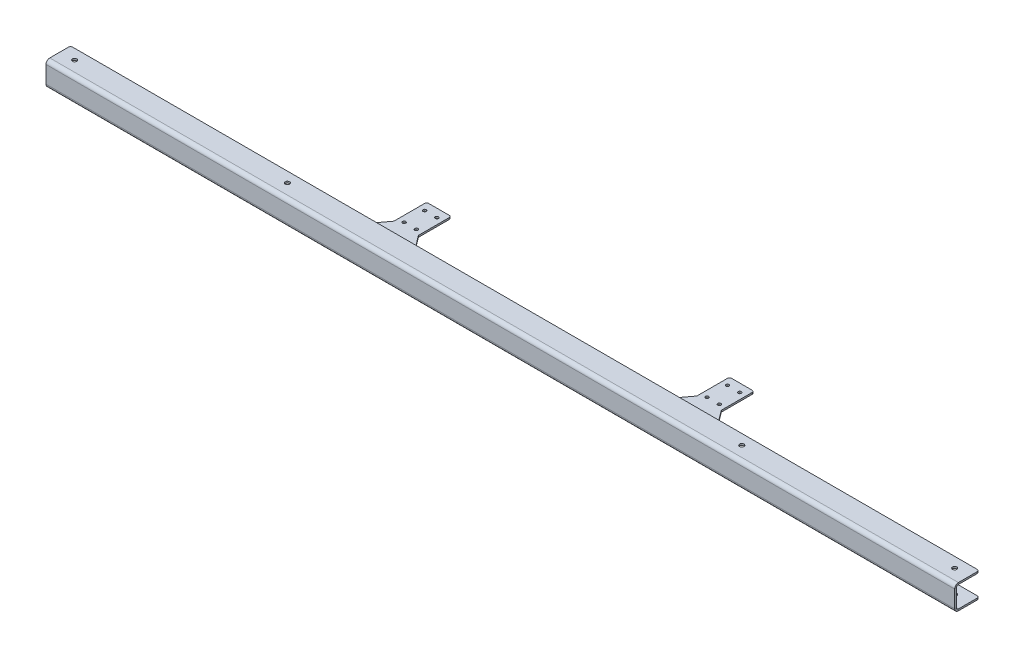
from build123d import *

# Parameters (mm, degrees)
BASE_FLANGE1_DEPTH               = 2.65684
EDGE_FLANGE3_STRIP_W             = 16.97736
EDGE_FLANGE3_STRIP_H             = 2.65684
EDGE_FLANGE3_STRIP_CUT_DEPTH     = 1409.7
EDGE_FLANGE3_DEPTH               = 1409.7
EDGE_FLANGE4_STRIP_W             = 16.97736
EDGE_FLANGE4_STRIP_H             = 2.65684
EDGE_FLANGE4_STRIP_CUT_DEPTH     = 1409.7
EDGE_FLANGE4_DEPTH               = 1409.7
F_10_0_1935_DIAMETER_HOLE1_D     = 4.9149
F_17_64_0_26563_DIAMETER_HOLE1_D = 6.747002
FILLET1_R                        = 3.175


# Sheet-metal steps are written as plain solids
with BuildPart() as part:
    # Sketch1 → Base-Flange1 (new body)
    with BuildSketch(Plane(origin=(0, 0, 0), x_dir=(1, 0, 0), z_dir=(0, 1, 0))):
        Polygon((0, 0), (1409.7, 0), (1409.7, 38.1), (996.95, 38.1), (958.85, 88.9), (958.85, 139.7), (920.75, 139.7), (920.75, 88.9), (882.65, 38.1), (527.05, 38.1), (488.95, 88.9), (488.95, 139.7), (450.85, 139.7), (450.85, 88.9), (412.75, 38.1), (0, 38.1), align=None)
    extrude(amount=-BASE_FLANGE1_DEPTH)

    # Edge-Flange3 strip (across the edge) → Edge-Flange3 strip cut (cut)
    with BuildSketch(Plane(origin=(0, 0, 0), x_dir=(0, 0, -1), z_dir=(1, 0, 0))):
        with Locations((-2.65684, -1.32842)):
            Rectangle(EDGE_FLANGE3_STRIP_W, EDGE_FLANGE3_STRIP_H)
    extrude(amount=EDGE_FLANGE3_STRIP_CUT_DEPTH, mode=Mode.SUBTRACT)

    # Edge-Flange3 section (across the edge) → Edge-Flange3 (add)
    with BuildSketch(Plane(origin=(0, 0, 0), x_dir=(0, 0, -1), z_dir=(1, 0, 0))):
        with BuildLine():
            Line((0, 3.175), (0, 35.44316))
            Line((0, 35.44316), (2.65684, 35.44316))
            Line((2.65684, 35.44316), (2.65684, 3.175))
            ThreePointArc((2.65684, 3.175), (3.58677597, 0.92993597), (5.83184, 0))
            Line((5.83184, 0), (5.83184, -2.65684))
            ThreePointArc((5.83184, -2.65684), (1.708106389, -0.948733611), (0, 3.175))
        make_face()
    extrude(amount=EDGE_FLANGE3_DEPTH)

    # Edge-Flange4 strip (across the edge) → Edge-Flange4 strip cut (cut)
    with BuildSketch(Plane(origin=(0, 35.44316, -2.65684), x_dir=(0, -1, 0), z_dir=(1, 0, 0))):
        with Locations((-2.65684, -1.32842)):
            Rectangle(EDGE_FLANGE4_STRIP_W, EDGE_FLANGE4_STRIP_H)
    extrude(amount=EDGE_FLANGE4_STRIP_CUT_DEPTH, mode=Mode.SUBTRACT)

    # Edge-Flange4 section (across the edge) → Edge-Flange4 (add)
    with BuildSketch(Plane(origin=(0, 35.44316, -2.65684), x_dir=(0, -1, 0), z_dir=(1, 0, 0))):
        with BuildLine():
            Line((0, 3.175), (0, 35.44316))
            Line((0, 35.44316), (2.65684, 35.44316))
            Line((2.65684, 35.44316), (2.65684, 3.175))
            ThreePointArc((2.65684, 3.175), (3.58677597, 0.92993597), (5.83184, 0))
            Line((5.83184, 0), (5.83184, -2.65684))
            ThreePointArc((5.83184, -2.65684), (1.708106389, -0.948733611), (0, 3.175))
        make_face()
    extrude(amount=EDGE_FLANGE4_DEPTH)

    # #10 (0.1935) Diameter Hole1 (through all)
    with Locations(Plane(origin=(0, -2.65684, 0), x_dir=(-1, 0, 0), z_dir=(0, -1, 0))):
        with Locations((-460.375, 127), (-479.425, 127), (-460.375, 63.5), (-479.425, 63.5), (-460.375, 95.25), (-479.425, 95.25), (-930.275, 63.5), (-949.325, 63.5), (-930.275, 95.25), (-949.325, 95.25), (-949.325, 127), (-930.275, 127)):
            Hole(F_10_0_1935_DIAMETER_HOLE1_D / 2)

    # 17/64 (0.26563) Diameter Hole1 (through all)
    with Locations(Plane(origin=(0, 35.44316, 0), x_dir=(1, 0, 0), z_dir=(0, 1, 0))):
        with Locations((22.225, 22.225), (1057.275, 22.225), (1387.475, 22.225), (352.425, 22.225)):
            Hole(F_17_64_0_26563_DIAMETER_HOLE1_D / 2)

    # Fillet1
    fillet1_edges = [part.edges().sort_by_distance(p)[0] for p in [
        (0, -1.32842, -38.1),
        (0, 34.11474, -38.1),
        (1409.7, 34.11474, -38.1),
        (1409.7, -1.32842, -38.1),
        (450.85, -1.32842, -139.7),
        (488.95, -1.32842, -139.7),
        (958.85, -1.32842, -139.7),
        (920.75, -1.32842, -139.7),
    ]]
    fillet(fillet1_edges, radius=FILLET1_R)


solid = part.part
